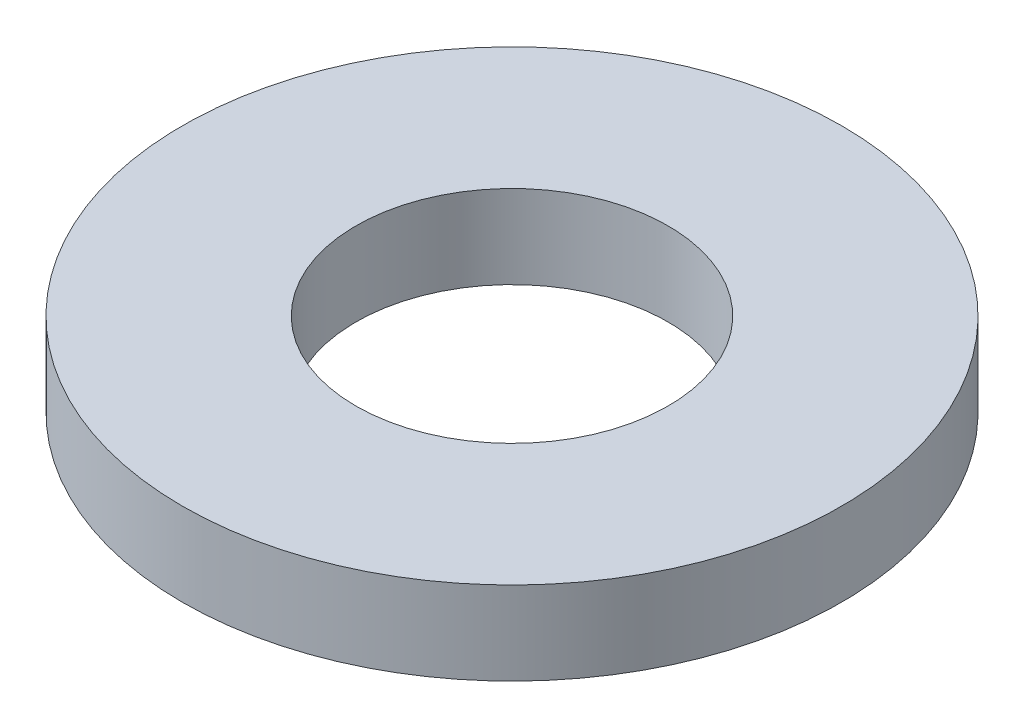
from build123d import *

# Parameters (mm, degrees)
SKETCH1_R           = 95
BOSS_EXTRUDE1_DEPTH = 24
SKETCH2_R           = 45
CUT_EXTRUDE1_DEPTH  = 137.477104307


with BuildPart() as part:
    # Sketch1 → Boss-Extrude1 (new body)
    with BuildSketch(Plane(origin=(0, 0, 0), x_dir=(1, 0, 0), z_dir=(0, 1, 0))):
        Circle(SKETCH1_R)
    extrude(amount=BOSS_EXTRUDE1_DEPTH)

    # Sketch2 → Cut-Extrude1 (cut, through all)
    with BuildSketch(Plane(origin=(0, 0, 0), x_dir=(1, 0, 0), z_dir=(0, 1, 0))):
        Circle(SKETCH2_R)
    extrude(amount=CUT_EXTRUDE1_DEPTH, mode=Mode.SUBTRACT)


solid = part.part
